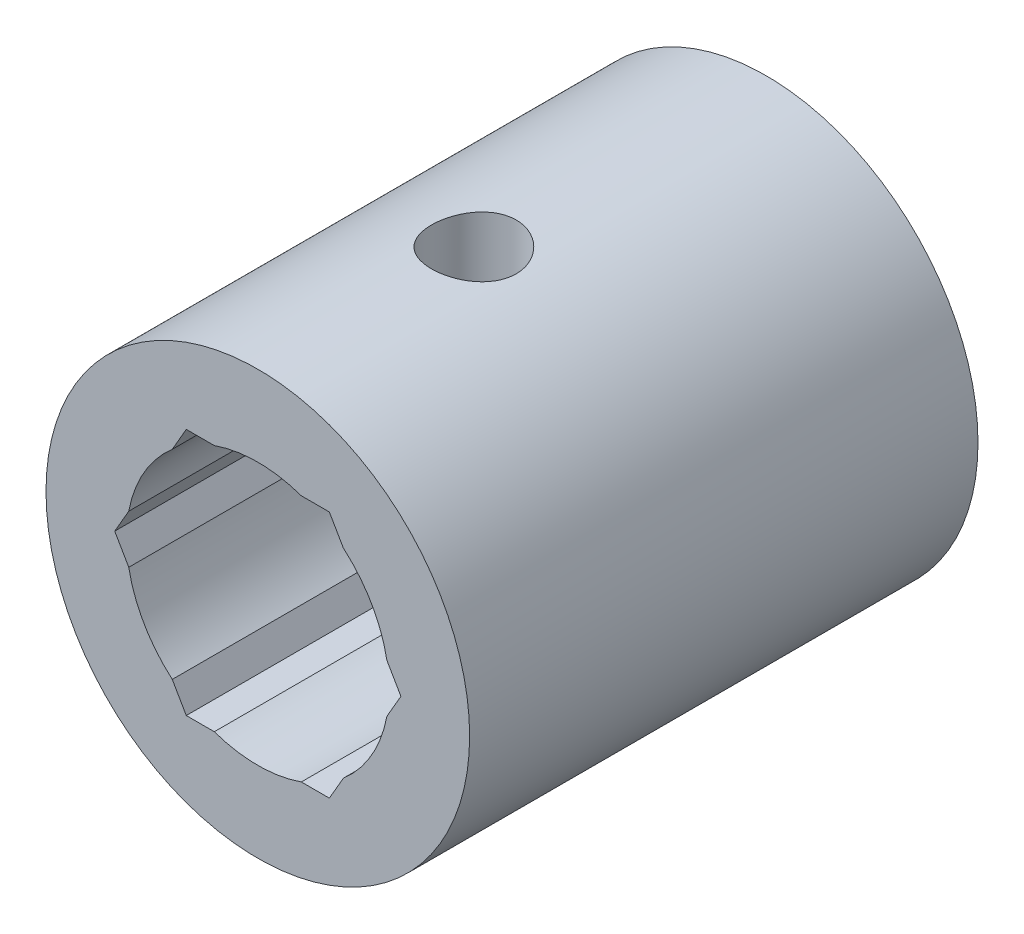
from build123d import *

# Parameters (mm, degrees)
SKETCH1_R               = 5
BOSS_EXTRUDE1_DEPTH     = 6
SKETCH2_R               = 3
CUT_EXTRUDE1_DEPTH      = 10
CUT_EXTRUDE2_DEPTH      = 13.247448714
MOVE_START              = -4
MOVE_FACE1_DEPTH        = 10
MOVE_FACE2_DEPTH        = 10
SKETCH4_R               = 1.7
CUT_EXTRUDE3_DEPTH      = 14.928388277
CUT_EXTRUDE7_DEPTH      = 10.273618495
CUT_EXTRUDE7_DEPTH_BACK = 10.273618495
SKETCH10_R              = 1


# Read off the part's stored shape, not the designer's step: Move Face1, Move Face2
with BuildPart() as part:
    # Sketch1 → Boss-Extrude1 (new, symmetric)
    with BuildSketch(Plane.XY):
        Circle(SKETCH1_R)
    extrude(amount=BOSS_EXTRUDE1_DEPTH, both=True)

    # Sketch2 → Cut-Extrude1 (cut)
    with BuildSketch(Plane.XY.offset(6)):
        Circle(SKETCH2_R)
    extrude(amount=-CUT_EXTRUDE1_DEPTH, mode=Mode.SUBTRACT)

    # Sketch3 → Cut-Extrude2 (cut, through all)
    with BuildSketch(Plane.XY.offset(-4)):
        Polygon((1.573279484, 2.725), (-1.573279484, 2.725), (-3.146558967, 0), (-1.573279484, -2.725), (1.573279484, -2.725), (3.146558967, 0), align=None)
    extrude(amount=CUT_EXTRUDE2_DEPTH, mode=Mode.SUBTRACT)

    # Move Face1 outline → Move Face1 (cut)
    with BuildSketch(Plane.XY.offset(MOVE_START)):
        with BuildLine():
            Line((2.866431597, -0.885194838), (3.377499075, 0))
            Line((3.377499075, 0), (2.866431597, 0.885194838))
            ThreePointArc((2.866431597, 0.885194838), (2.942674777, 0.583665277), (2.98728973, 0.275862411))
            Line((2.98728973, 0.275862411), (3.146558967, 0))
            Line((3.146558967, 0), (2.98728973, -0.275862411))
            ThreePointArc((2.98728973, -0.275862411), (2.942674777, -0.583665277), (2.866431597, -0.885194838))
        make_face()
        with BuildLine():
            Line((1.688749537, -2.925), (2.199817015, -2.039805162))
            ThreePointArc((2.199817015, -2.039805162), (1.976806346, -2.256598473), (1.732548721, -2.449137589))
            Line((1.732548721, -2.449137589), (1.573279484, -2.725))
            Line((1.573279484, -2.725), (1.254741009, -2.725))
            ThreePointArc((1.254741009, -2.725), (0.965868431, -2.840263751), (0.666614581, -2.925))
            Line((0.666614581, -2.925), (1.688749537, -2.925))
        make_face()
        with BuildLine():
            ThreePointArc((1.732548721, 2.449137589), (1.976806346, 2.256598473), (2.199817015, 2.039805162))
            Line((2.199817015, 2.039805162), (1.688749537, 2.925))
            Line((1.688749537, 2.925), (0.666614581, 2.925))
            ThreePointArc((0.666614581, 2.925), (0.965868431, 2.840263751), (1.254741009, 2.725))
            Line((1.254741009, 2.725), (1.573279484, 2.725))
            Line((1.573279484, 2.725), (1.732548721, 2.449137589))
        make_face()
        with BuildLine():
            Line((-1.688749537, -2.925), (-0.666614581, -2.925))
            ThreePointArc((-0.666614581, -2.925), (-0.965868431, -2.840263751), (-1.254741009, -2.725))
            Line((-1.254741009, -2.725), (-1.573279484, -2.725))
            Line((-1.573279484, -2.725), (-1.732548721, -2.449137589))
            ThreePointArc((-1.732548721, -2.449137589), (-1.976806346, -2.256598473), (-2.199817015, -2.039805162))
            Line((-2.199817015, -2.039805162), (-1.688749537, -2.925))
        make_face()
        with BuildLine():
            ThreePointArc((-1.254741009, 2.725), (-0.965868431, 2.840263751), (-0.666614581, 2.925))
            Line((-0.666614581, 2.925), (-1.688749537, 2.925))
            Line((-1.688749537, 2.925), (-2.199817015, 2.039805162))
            ThreePointArc((-2.199817015, 2.039805162), (-1.976806346, 2.256598473), (-1.732548721, 2.449137589))
            Line((-1.732548721, 2.449137589), (-1.573279484, 2.725))
            Line((-1.573279484, 2.725), (-1.254741009, 2.725))
        make_face()
        with BuildLine():
            Line((-3.377499075, 0), (-2.866431597, -0.885194838))
            ThreePointArc((-2.866431597, -0.885194838), (-2.942674777, -0.583665277), (-2.98728973, -0.275862411))
            Line((-2.98728973, -0.275862411), (-3.146558967, 0))
            Line((-3.146558967, 0), (-2.98728973, 0.275862411))
            ThreePointArc((-2.98728973, 0.275862411), (-2.942674777, 0.583665277), (-2.866431597, 0.885194838))
            Line((-2.866431597, 0.885194838), (-3.377499075, 0))
        make_face()
    extrude(amount=MOVE_FACE1_DEPTH, mode=Mode.SUBTRACT)

    # Move Face2 outline → Move Face2 (cut)
    with BuildSketch(Plane.XY.offset(MOVE_START)):
        with BuildLine():
            Line((2.866431597, 0.885194838), (3.046538126, 0.573241179))
            ThreePointArc((3.046538126, 0.573241179), (2.684678752, 1.55), (2.019710487, 2.351758821))
            Line((2.019710487, 2.351758821), (2.199817015, 2.039805162))
            ThreePointArc((2.199817015, 2.039805162), (2.598076211, 1.5), (2.866431597, 0.885194838))
        make_face()
        with BuildLine():
            ThreePointArc((2.019710487, -2.351758821), (2.684678752, -1.55), (3.046538126, -0.573241179))
            Line((3.046538126, -0.573241179), (2.866431597, -0.885194838))
            ThreePointArc((2.866431597, -0.885194838), (2.598076211, -1.5), (2.199817015, -2.039805162))
            Line((2.199817015, -2.039805162), (2.019710487, -2.351758821))
        make_face()
        with BuildLine():
            Line((0.666614581, 2.925), (1.026827639, 2.925))
            ThreePointArc((1.026827639, 2.925), (0, 3.1), (-1.026827639, 2.925))
            Line((-1.026827639, 2.925), (-0.666614581, 2.925))
            ThreePointArc((-0.666614581, 2.925), (0, 3), (0.666614581, 2.925))
        make_face()
        with BuildLine():
            ThreePointArc((-1.026827639, -2.925), (0, -3.1), (1.026827639, -2.925))
            Line((1.026827639, -2.925), (0.666614581, -2.925))
            ThreePointArc((0.666614581, -2.925), (0, -3), (-0.666614581, -2.925))
            Line((-0.666614581, -2.925), (-1.026827639, -2.925))
        make_face()
        with BuildLine():
            Line((-2.199817015, 2.039805162), (-2.019710487, 2.351758821))
            ThreePointArc((-2.019710487, 2.351758821), (-2.684678752, 1.55), (-3.046538126, 0.573241179))
            Line((-3.046538126, 0.573241179), (-2.866431597, 0.885194838))
            ThreePointArc((-2.866431597, 0.885194838), (-2.598076211, 1.5), (-2.199817015, 2.039805162))
        make_face()
        with BuildLine():
            ThreePointArc((-3.046538126, -0.573241179), (-2.684678752, -1.55), (-2.019710487, -2.351758821))
            Line((-2.019710487, -2.351758821), (-2.199817015, -2.039805162))
            ThreePointArc((-2.199817015, -2.039805162), (-2.598076211, -1.5), (-2.866431597, -0.885194838))
            Line((-2.866431597, -0.885194838), (-3.046538126, -0.573241179))
        make_face()
    extrude(amount=MOVE_FACE2_DEPTH, mode=Mode.SUBTRACT)

    # Sketch4 → Cut-Extrude3 (cut, through all)
    with BuildSketch(Plane(origin=(0, 0, -6), x_dir=(-1, 0, 0), z_dir=(0, 0, -1))):
        Circle(SKETCH4_R)
    extrude(amount=-CUT_EXTRUDE3_DEPTH, mode=Mode.SUBTRACT)

    # Sketch10 → Cut-Extrude7 (cut, two sides: drawn at the far end of the back side and taken through both)
    with BuildSketch(Plane(origin=(0, 0, 0), x_dir=(1, 0, 0), z_dir=(0, 1, 0)).offset(-CUT_EXTRUDE7_DEPTH_BACK)):
        with Locations(Location((0, -0.9, 0), (0, 0, 270))):
            Circle(SKETCH10_R)
    extrude(amount=CUT_EXTRUDE7_DEPTH + CUT_EXTRUDE7_DEPTH_BACK, mode=Mode.SUBTRACT)


solid = part.part
